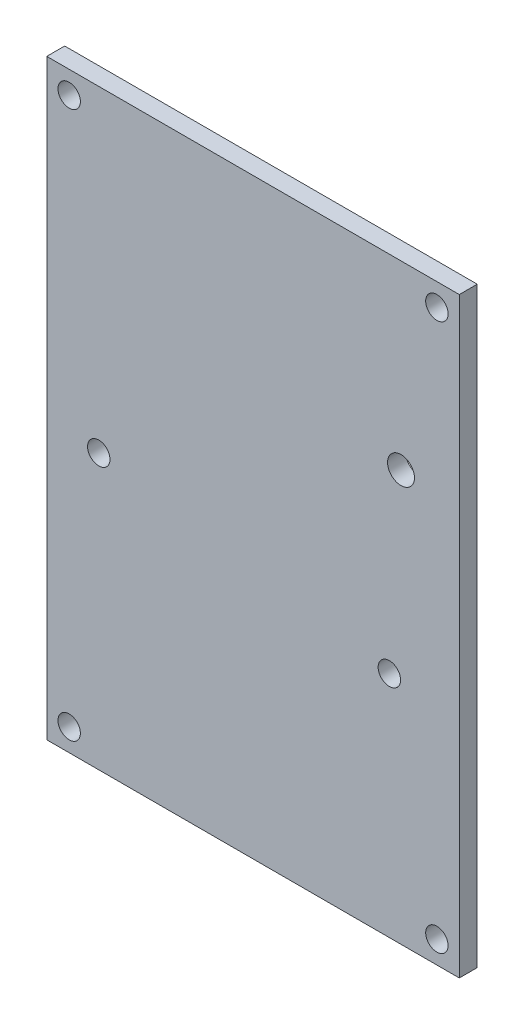
from build123d import *

# Parameters (mm, degrees)
SKETCH1_W             = 46
SKETCH1_H             = 66
BOSS_EXTRUDE1_DEPTH   = 2
F_2_5MM_DOWEL_HOLE1_D = 2.5
F_3_0MM_DOWEL_HOLE1_D = 3


with BuildPart() as part:
    # Sketch1 → Boss-Extrude1 (new body)
    with BuildSketch(Plane.XY):
        Rectangle(SKETCH1_W, SKETCH1_H)
    extrude(amount=BOSS_EXTRUDE1_DEPTH)

    # Ø2.5mm Dowel Hole1 (through all)
    with Locations(Plane.XY.offset(2)):
        with Locations((-20.5, 30.5), (20.5, 30.5), (20.5, -30.5), (-20.5, -30.5), (-17.2, -2.4), (15.2, -7.5)):
            Hole(F_2_5MM_DOWEL_HOLE1_D / 2)

    # Ø3.0mm Dowel Hole1 (through all)
    with Locations(Plane.XY.offset(2)):
        with Locations((16.5, 12.8)):
            Hole(F_3_0MM_DOWEL_HOLE1_D / 2)


solid = part.part
